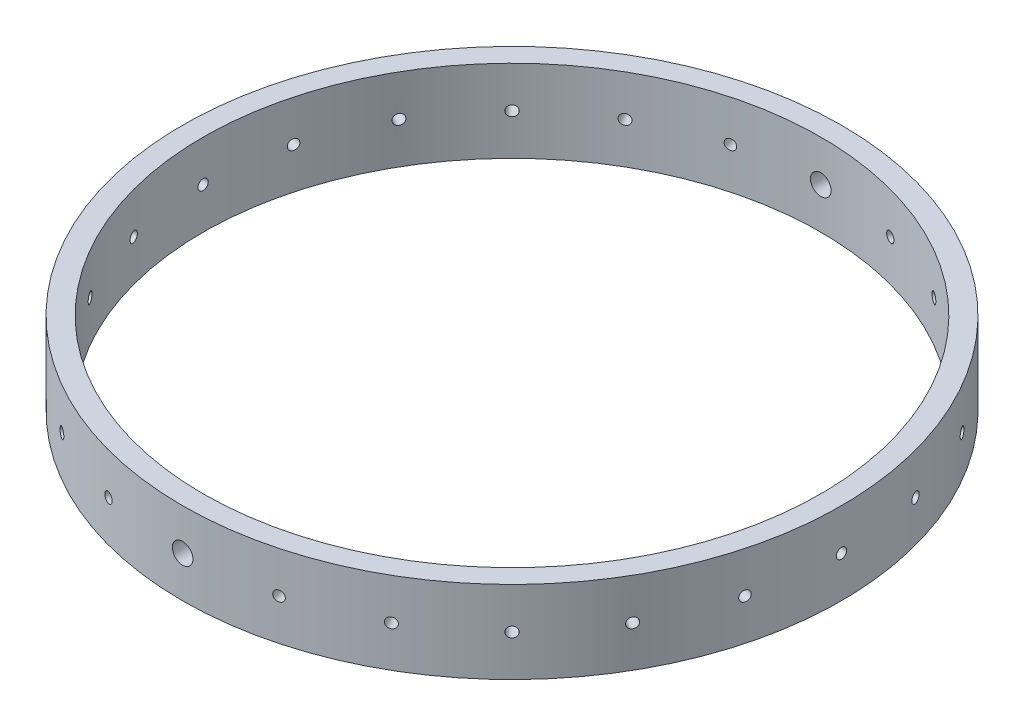
from build123d import *

# Parameters (mm, degrees)
SKETCH1_R               = 101.6
SKETCH1_R_2             = 95.25
BOSS_EXTRUDE1_DEPTH     = 25.4
CUT_EXTRUDE1_DEPTH      = 146.911891222
CUT_EXTRUDE1_DEPTH_BACK = 146.911891222
SKETCH2_R               = 3.175
SKETCH3_R               = 1.5875
CUT_EXTRUDE3_DEPTH      = 146.911891379
CIRPATTERN1_COUNT       = 24


with BuildPart() as part:
    # Sketch1 → Boss-Extrude1 (new body)
    with BuildSketch(Plane(origin=(0, 0, 0), x_dir=(1, 0, 0), z_dir=(0, 1, 0))):
        Circle(SKETCH1_R)
        Circle(SKETCH1_R_2, mode=Mode.SUBTRACT)
    extrude(amount=BOSS_EXTRUDE1_DEPTH)

    # Sketch2 → Cut-Extrude1 (cut, two sides: drawn at the far end of the back side and taken through both)
    with BuildSketch(Plane.XY.offset(-CUT_EXTRUDE1_DEPTH_BACK)):
        with Locations((0, 12.7)):
            Circle(SKETCH2_R)
    extrude(amount=CUT_EXTRUDE1_DEPTH + CUT_EXTRUDE1_DEPTH_BACK, mode=Mode.SUBTRACT)

    # Sketch3 → Cut-Extrude3 (cut, through all)
    with BuildSketch(Plane(origin=(0, 0, 0), x_dir=(0, 0, -1), z_dir=(1, 0, 0))):
        with Locations((0, 12.7)):
            Circle(SKETCH3_R)
    cut_extrude3 = extrude(amount=-CUT_EXTRUDE3_DEPTH, mode=Mode.SUBTRACT)

    # CirPattern1: Cut-Extrude3 ×24 about axis
    cirpattern1_axis = Axis((0, 0, 0), (0, 1, 0))
    for i in range(1, CIRPATTERN1_COUNT):
        add(cut_extrude3.rotate(cirpattern1_axis, i * 360 / CIRPATTERN1_COUNT), mode=Mode.SUBTRACT)


solid = part.part
